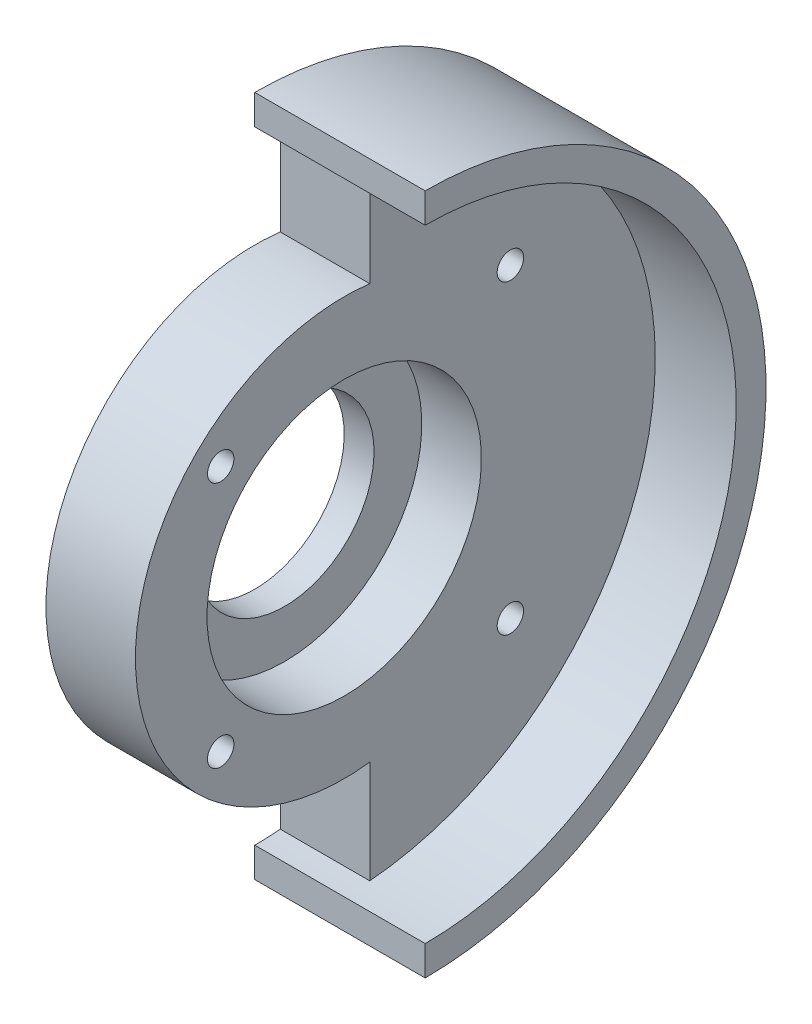
from build123d import *
from build123d.topology import SkipClean

# Parameters (mm, degrees)
CUT_EXTRUDE1_DEPTH      = 58.534772095
CUT_EXTRUDE1_DEPTH_BACK = 58.534772095
SKETCH2_R               = 1.55
SKETCH3_R               = 2.95
CUT_EXTRUDE2_DEPTH      = 5


with BuildPart() as part:
    # Sketch1 → Revolve1 (revolve)
    with BuildSketch(Plane.XY):
        Polygon((20, 40), (20, 36.5), (10.5, 36.5), (10.5, 16.1), (3.5, 16.1), (3.5, 10.5), (0, 10.5), (0, 40), align=None)
    revolve(axis=Axis((20, 0, 0), (-1, 0, 0)))

    # Sketch2 → Cut-Extrude1 (cut, two sides: drawn at the far end of the back side and taken through both)
    with SkipClean():  # the faces are left unmerged after this step: merging them gives an invalid solid
        with BuildSketch(Plane(origin=(10.5, 0, 0), x_dir=(0, 0, -1), z_dir=(1, 0, 0)).offset(-CUT_EXTRUDE1_DEPTH_BACK)):
            with Locations((-14.495689014, 14.495689014)):
                Circle(SKETCH2_R)
            with Locations((19.5, -17.944358445)):
                Circle(SKETCH2_R)
            with Locations((19.5, 17.944358445)):
                Circle(SKETCH2_R)
            with Locations((-14.495689014, -14.495689014)):
                Circle(SKETCH2_R)
            with BuildLine():
                Line((3, 24.315632832), (3, 36.376503405))
                ThreePointArc((3, 36.376503405), (1.501270413, 36.469112783), (0, 36.5))
                Line((0, 36.5), (0, 40))
                ThreePointArc((0, 40), (-40, 0), (0, -40))
                Line((0, -40), (0, -36.5))
                ThreePointArc((0, -36.5), (1.501270413, -36.469112783), (3, -36.376503405))
                Line((3, -36.376503405), (3, -24.315632832))
                ThreePointArc((3, -24.315632832), (-24.5, 0), (3, 24.315632832))
            make_face()
        extrude(amount=CUT_EXTRUDE1_DEPTH + CUT_EXTRUDE1_DEPTH_BACK, mode=Mode.SUBTRACT)

    # Sketch3 → Cut-Extrude2 (cut)
    with SkipClean():  # the faces are left unmerged after this step: merging them gives an invalid solid
        with BuildSketch(Plane.ZY):
            with Locations((-19.5, 17.944358445)):
                Circle(SKETCH3_R)
            with Locations((14.495689014, 14.495689014)):
                Circle(SKETCH3_R)
            with Locations((-19.5, -17.944358445)):
                Circle(SKETCH3_R)
            with Locations((14.495689014, -14.495689014)):
                Circle(SKETCH3_R)
        extrude(amount=-CUT_EXTRUDE2_DEPTH, mode=Mode.SUBTRACT)


solid = part.part
